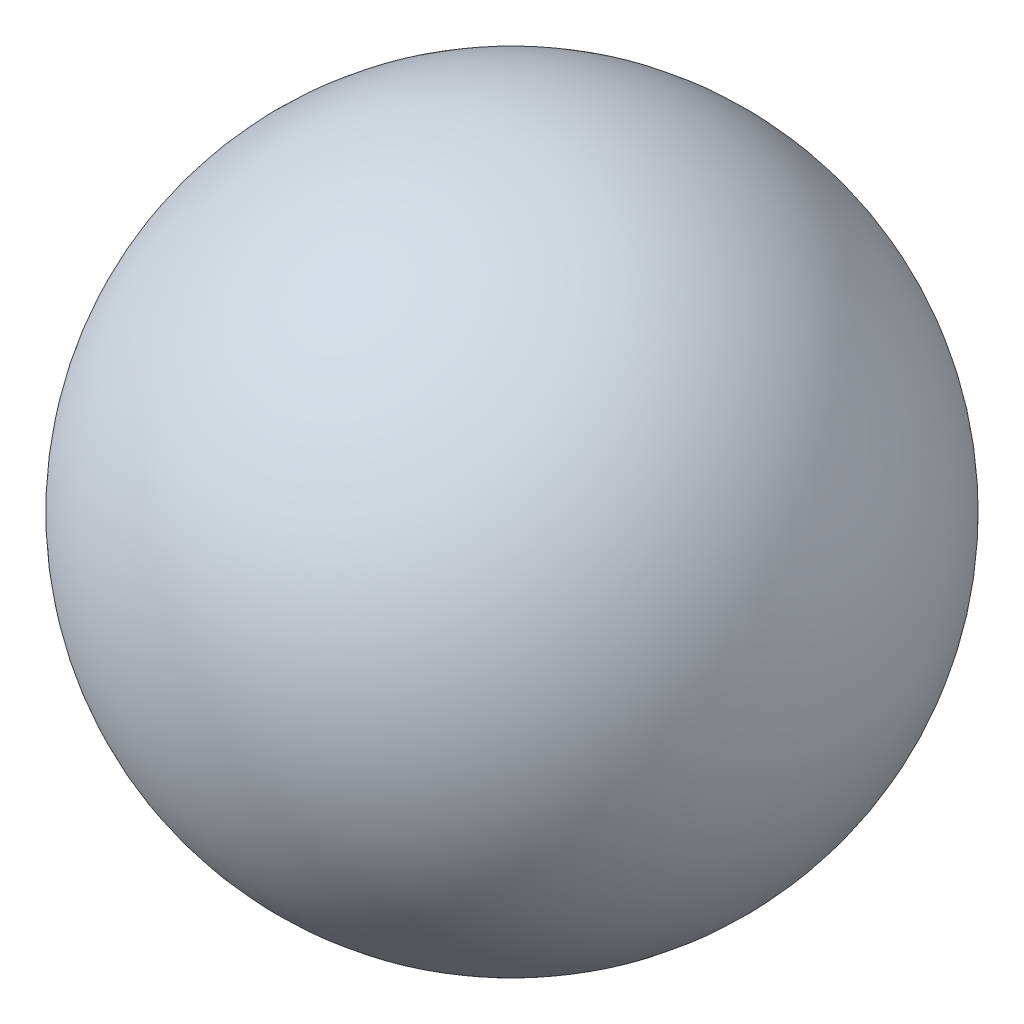
from build123d import *


with BuildPart() as part:
    # Sketch1 → Revolve1 (revolve)
    with BuildSketch(Plane.XY):
        with BuildLine():
            Line((0, 0), (0, 9.525))
            ThreePointArc((0, 9.525), (4.7625, 4.7625), (0, 0))
        make_face()
    revolve(axis=Axis((0, 0, 0), (0, 1, 0)))


solid = part.part
